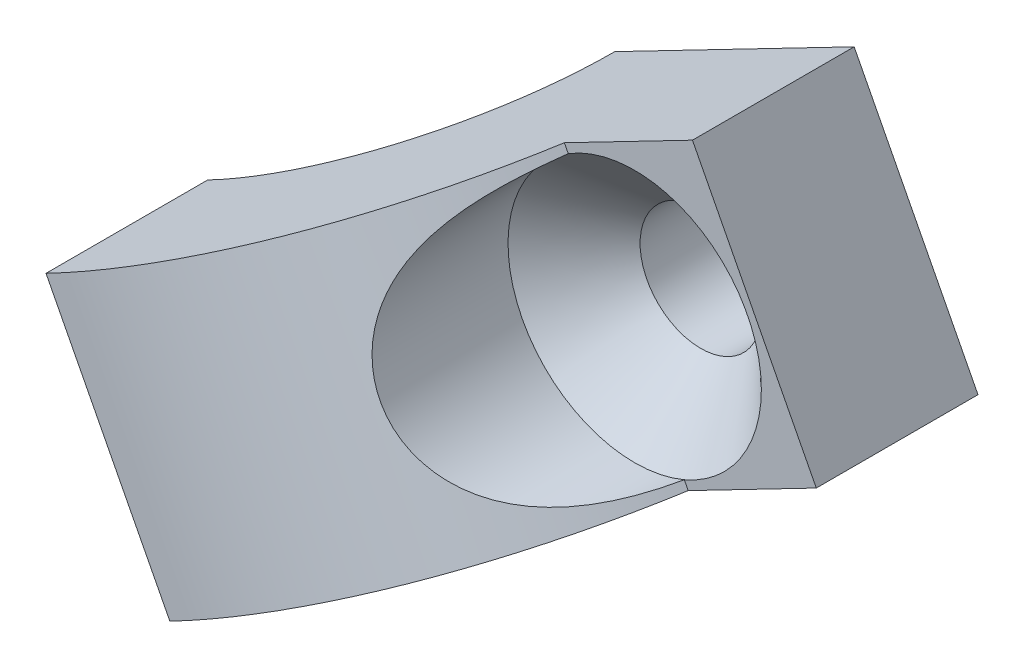
from build123d import *

# Parameters (mm, degrees)
EXTRUDE_1_DEPTH     = 5
CUT_EXTRUDE_1_REACH = 111.447
SKETCH_2_R          = 4.7


# Read off the part's stored shape, not the designer's step: 高级异型孔1
with BuildPart() as part:
    # 草图1 → 凸台-拉伸1 (new, symmetric)
    with BuildSketch(Plane(origin=(-122.072166326, -77.355926536, -12.049374423), x_dir=(0, 0, -1), z_dir=(-0.45954578368873344, 0.8881540816175468, 0))):
        with BuildLine():
            Line((-40, -48), (-40, -58))
            Line((-40, -58), (-46, -58))
            Line((-46, -58), (-46, -52.649110641))
            ThreePointArc((-46, -52.649110641), (-51.832159566, -47.483314774), (-54, -40))
            Line((-54, -40), (-48, -40))
            ThreePointArc((-48, -40), (-45.656854249, -45.656854249), (-40, -48))
        make_face()
    extrude(amount=EXTRUDE_1_DEPTH, both=True)

    # 高级异型孔1 outline → 高级异型孔1 (revolve, cut)
    with BuildSketch(Plane(origin=(-75, -53, 0), x_dir=(1, 0, 0), z_dir=(0, -1, 0))):
        Polygon((0, 27.950625577), (2.25, 27.950625577), (2.25, 31.500625577), (4.7, 33.950625577), (0, 33.950625577), align=None)
    revolve(axis=Axis((-75, -53, 0), (0, 0, 1)), mode=Mode.SUBTRACT)

    # 草图2 → 切除-拉伸1 (cut, up to next)
    with BuildSketch(Plane.XY.offset(33.950625577), mode=Mode.PRIVATE) as cut_extrude_1_sk1:
        with Locations((-75, -53)):
            Circle(SKETCH_2_R)
    cut_extrude_1_tool1 = extrude(cut_extrude_1_sk1.sketch, amount=CUT_EXTRUDE_1_REACH, mode=Mode.PRIVATE) & part.part
    add(cut_extrude_1_tool1.solids().sort_by_distance((-75, -53, 33.950626))[0], mode=Mode.SUBTRACT)


solid = part.part
